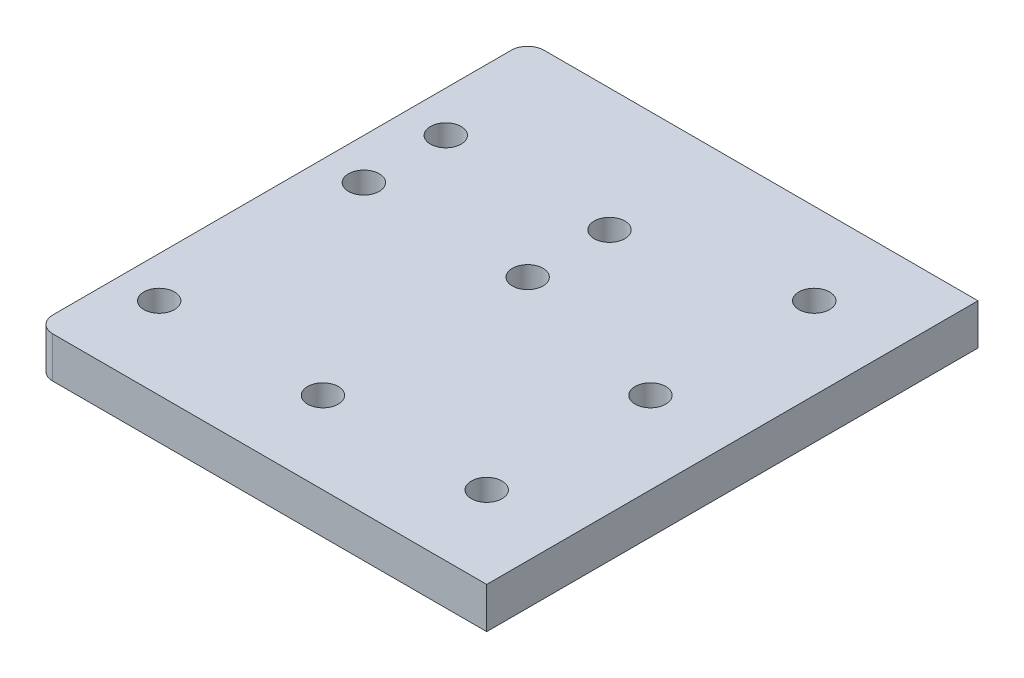
from build123d import *

# Parameters (mm, degrees)
SKETCH1_W           = 69.85
SKETCH1_H           = 76.2
SKETCH1_R           = 2.38125
BOSS_EXTRUDE1_DEPTH = 6.35
FILLET1_R           = 2.54


with BuildPart() as part:
    # Sketch1 → Boss-Extrude1 (new body)
    with BuildSketch(Plane(origin=(0, 0, 0), x_dir=(1, 0, 0), z_dir=(0, 1, 0))):
        Rectangle(SKETCH1_W, SKETCH1_H)
        with Locations((22.225, 0)):
            Circle(SKETCH1_R, mode=Mode.SUBTRACT)
        with Locations((22.225, -25.4)):
            Circle(SKETCH1_R, mode=Mode.SUBTRACT)
        with Locations((22.225, 25.4)):
            Circle(SKETCH1_R, mode=Mode.SUBTRACT)
        with Locations((-28.575, -25.4)):
            Circle(SKETCH1_R, mode=Mode.SUBTRACT)
        with Locations((-28.575, 19.05)):
            Circle(SKETCH1_R, mode=Mode.SUBTRACT)
        with Locations((-28.575, 6.35)):
            Circle(SKETCH1_R, mode=Mode.SUBTRACT)
        with Locations((-3.175, -25.4)):
            Circle(SKETCH1_R, mode=Mode.SUBTRACT)
        with Locations((-3.175, 19.05)):
            Circle(SKETCH1_R, mode=Mode.SUBTRACT)
        with Locations((-3.175, 6.35)):
            Circle(SKETCH1_R, mode=Mode.SUBTRACT)
    extrude(amount=BOSS_EXTRUDE1_DEPTH)

    # Fillet1
    fillet1_edges = [part.edges().sort_by_distance(p)[0] for p in [
        (-34.925, 3.175, -38.1),
        (-34.925, 3.175, 38.1),
    ]]
    fillet(fillet1_edges, radius=FILLET1_R)


solid = part.part
